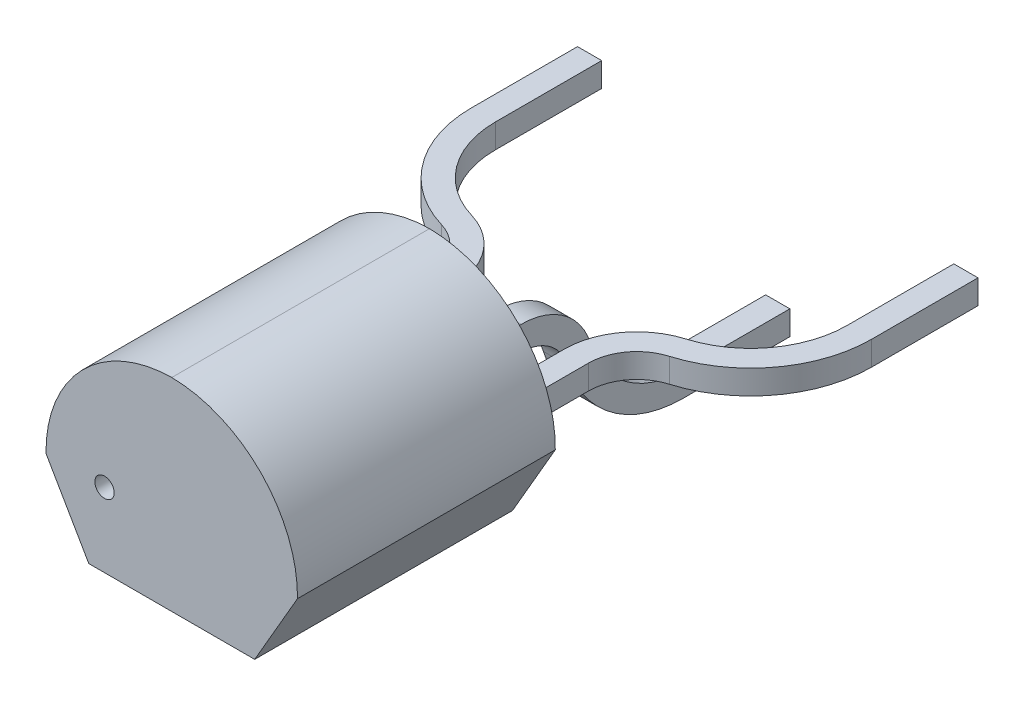
from build123d import *

# Parameters (mm, degrees)
EXTRUDE_1_DEPTH     = 5.33
SKETCH_1_W          = 0.5
SKETCH_1_H          = 0.5
EXTRUDE_2_DEPTH     = 2.54
SKETCH_1_2_W        = 0.5
SKETCH_1_2_H        = 0.5
EXTRUDE_3_DEPTH     = 10.16
SKETCH_4_R          = 0.2
CUT_EXTRUDE_1_DEPTH = 0.5
SKETCH_5_W          = 0.5
SKETCH_5_H          = 10.2
EXTRUDE_4_DEPTH     = 2.5
SKETCH_6_W          = 10.2
SKETCH_6_H          = 0.5
EXTRUDE_5_DEPTH     = 2.5
SKETCH_7_W          = 10.2
SKETCH_7_H          = 0.5
EXTRUDE_6_DEPTH     = 2.5
FILLET_1_R          = 2.5
FILLET_2_R          = 1
CUT_EXTRUDE_2_DEPTH = 2.5
CUT_EXTRUDE_3_DEPTH = 1
SKETCH_11_W         = 10.061772152
SKETCH_11_H         = 6.60723038
CUT_EXTRUDE_4_DEPTH = 5.5
SKETCH_12_R         = 0.156456915
CUT_EXTRUDE_5_DEPTH = 1


with BuildPart() as part:
    # Эскиз3 → Вытянуть1 (new body)
    with BuildSketch(Plane.XY.offset(2.54)):
        with BuildLine():
            Line((-0.325, -1.53), (3.105, -1.53))
            Line((3.105, -1.53), (3.99, 0))
            ThreePointArc((3.99, 0), (3.240904038, 1.868477631), (1.39, 2.66))
            ThreePointArc((1.39, 2.66), (-0.460904038, 1.868477631), (-1.21, 0))
            Line((-1.21, 0), (-0.325, -1.53))
        make_face()
    extrude(amount=EXTRUDE_1_DEPTH)

    # Эскиз1 → Вытянуть2 (add)
    with BuildSketch(Plane.XY):
        with Locations((1.39, 0)):
            Rectangle(SKETCH_1_W, SKETCH_1_H)
        Rectangle(SKETCH_1_W, SKETCH_1_H)
        with Locations((2.78, 0)):
            Rectangle(SKETCH_1_W, SKETCH_1_H)
    extrude(amount=EXTRUDE_2_DEPTH)

    # Эскиз1<2> → Вытянуть3 (add)
    with BuildSketch(Plane.XY):
        with Locations((1.39, 0)):
            Rectangle(SKETCH_1_2_W, SKETCH_1_2_H)
        Rectangle(SKETCH_1_2_W, SKETCH_1_2_H)
        with Locations((2.78, 0)):
            Rectangle(SKETCH_1_2_W, SKETCH_1_2_H)
    extrude(amount=-EXTRUDE_3_DEPTH)

    # Эскиз4 → Вырез-Вытянуть1 (cut)
    with BuildSketch(Plane.XY.offset(7.87)):
        Circle(SKETCH_4_R)
    extrude(amount=-CUT_EXTRUDE_1_DEPTH, mode=Mode.SUBTRACT)

    # Эскиз5 → Вытянуть4 (add)
    with BuildSketch(Plane(origin=(0, -0.25, 0), x_dir=(1, 0, 0), z_dir=(0, 1, 0))):
        with Locations((1.39, 5.06)):
            Rectangle(SKETCH_5_W, SKETCH_5_H)
    extrude(amount=-EXTRUDE_4_DEPTH)

    # Эскиз6 → Вытянуть5 (add)
    with BuildSketch(Plane.ZY.offset(0.25)):
        with Locations((-5.06, 0)):
            Rectangle(SKETCH_6_W, SKETCH_6_H)
    extrude(amount=EXTRUDE_5_DEPTH)

    # Эскиз7 → Вытянуть6 (add)
    with BuildSketch(Plane(origin=(3.03, 0, 0), x_dir=(0, 0, -1), z_dir=(1, 0, 0))):
        with Locations((5.06, 0)):
            Rectangle(SKETCH_7_W, SKETCH_7_H)
    extrude(amount=EXTRUDE_6_DEPTH)

    # Скругление1
    fillet_1_edges = [part.edges().sort_by_distance(p)[0] for p in [
        (5.53, 0, 0.04),
        (-2.75, 0, 0.04),
        (1.39, -2.75, 0.04),
    ]]
    fillet(fillet_1_edges, radius=FILLET_1_R - 0.0001)  # a hair under: the kernel refuses the full size

    # Скругление2
    fillet_2_edges = [part.edges().sort_by_distance(p)[0] for p in [
        (-0.25, 0, 0.04),
        (3.03, 0, 0.04),
        (1.39, -0.25, 0.04),
    ]]
    fillet(fillet_2_edges, radius=FILLET_2_R)

    # Эскиз9 → Вырез-Вытянуть2 (cut)
    with BuildSketch(Plane.XZ.offset(0.25)):
        with BuildLine():
            Line((-2.25, -10.16), (-2.25, -2.46))
            ThreePointArc((-2.25, -2.46), (-1.853567451, -1.264771391), (-0.821428571, -0.543370305))
            ThreePointArc((-0.821428571, -0.543370305), (-0.047324411, -0.002319491), (0.25, 0.894101966))
            Line((0.25, 0.894101966), (0.25, -10.16))
            Line((0.25, -10.16), (-2.25, -10.16))
        make_face()
        with BuildLine():
            Line((5.03, -10.16), (2.53, -10.16))
            Line((2.53, -10.16), (2.53, 0.894101966))
            ThreePointArc((2.53, 0.894101966), (2.827324411, -0.002319491), (3.601428571, -0.543370305))
            ThreePointArc((3.601428571, -0.543370305), (4.633567451, -1.264771391), (5.03, -2.46))
            Line((5.03, -2.46), (5.03, -10.16))
        make_face()
    extrude(amount=-CUT_EXTRUDE_2_DEPTH, mode=Mode.SUBTRACT)

    # Эскиз10 → Вырез-Вытянуть3 (cut)
    with BuildSketch(Plane.ZY.offset(-1.14)):
        with BuildLine():
            Line((-2.46, -2.25), (-10.16, -2.25))
            Line((-10.16, -2.25), (-10.16, 0.25))
            Line((-10.16, 0.25), (0.894101966, 0.25))
            ThreePointArc((0.894101966, 0.25), (-0.002319491, -0.047324411), (-0.543370305, -0.821428571))
            ThreePointArc((-0.543370305, -0.821428571), (-1.264771391, -1.853567451), (-2.46, -2.25))
        make_face()
    extrude(amount=-CUT_EXTRUDE_3_DEPTH, mode=Mode.SUBTRACT)

    # Эскиз11 → Вырез-Вытянуть4 (cut)
    with BuildSketch(Plane(origin=(0, 0, -10.16), x_dir=(-1, 0, 0), z_dir=(0, 0, -1))):
        with Locations((-1.088146835, -1.646498734)):
            Rectangle(SKETCH_11_W, SKETCH_11_H)
    extrude(amount=-CUT_EXTRUDE_4_DEPTH, mode=Mode.SUBTRACT)

    # Эскиз12 → Вырез-Вытянуть5 (cut)
    with BuildSketch(Plane(origin=(0, 0, -4.66), x_dir=(-1, 0, 0), z_dir=(0, 0, -1))):
        with Locations((-1.39, -2.5)):
            Circle(SKETCH_12_R)
    extrude(amount=-CUT_EXTRUDE_5_DEPTH, mode=Mode.SUBTRACT)


solid = part.part
